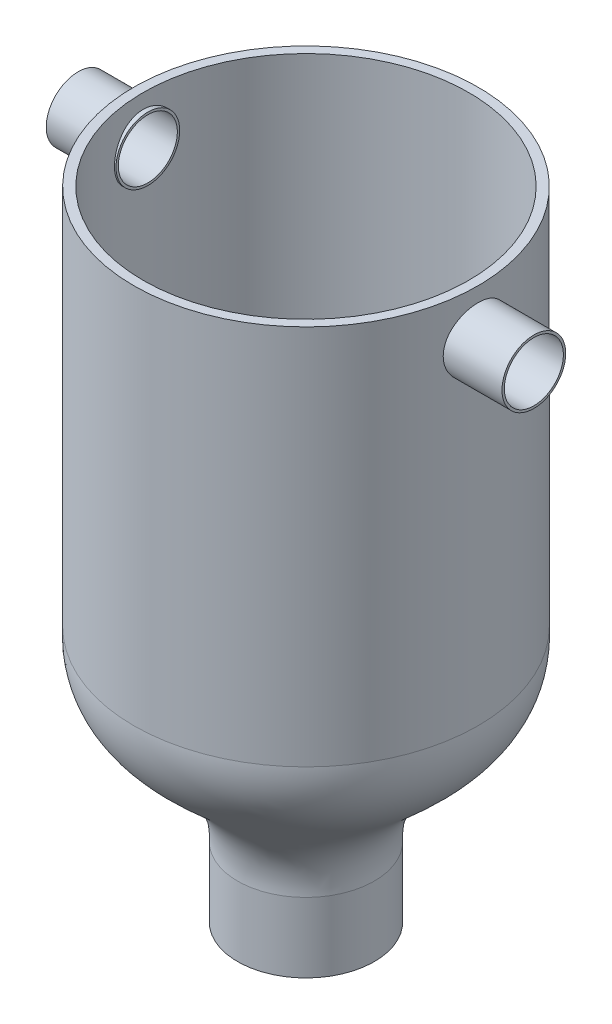
from build123d import *

# Parameters (mm, degrees)
REVOLVE1_OUTLINE_W   = 2
REVOLVE1_OUTLINE_H   = 0.065149557
REVOLVE1_OUTLINE_H_2 = 81.934850443
SKETCH2_R            = 14.704320858
SKETCH2_R_2          = 12.7
BOSS_EXTRUDE1_DEPTH  = 15
SKETCH4_R            = 6.85
SKETCH4_R_2          = 6.35
BOSS_EXTRUDE2_DEPTH  = 15
SKETCH4_5_R          = 6.35
CUT_EXTRUDE4_DEPTH   = 15


# Read off the part's stored shape, not the designer's step: Revolve1
with BuildPart() as part:
    # Revolve1 outline → Revolve1 (revolve)
    with BuildSketch(Plane.XY):
        with BuildLine():
            Line((37, -80), (35, -80))
            add(Edge.make_bspline(
                [(35, -82.736135297), (35.061393787, -81.864251908), (35.063596331, -80.953652605), (35, -80)],
                knots=[0.949778886, 0.949778886, 0.949778886, 0.949778886, 1, 1, 1, 1], degree=3))
            Line((35, -82.736135297), (35, -90.191453928))
            add(Edge.make_bspline(
                [(37, -82.809632302), (36.978250196, -83.133593549), (36.836525309, -84.679504253), (36.291315776, -87.236669301), (35.466188994, -89.257499139), (35, -90.191453928)],
                knots=[0.049019822, 0.049019822, 0.049019822, 0.049019822, 0.065850528, 0.130607861, 0.192149403, 0.192149403, 0.192149403, 0.192149403], degree=3))
            Line((37, -82.809632302), (37, -80))
        make_face()
        with Locations((36, -79.967425222)):
            Rectangle(REVOLVE1_OUTLINE_W, REVOLVE1_OUTLINE_H)
        with Locations((36, -38.967425222)):
            Rectangle(REVOLVE1_OUTLINE_W, REVOLVE1_OUTLINE_H_2)
        with BuildLine():
            Line((35, -90.191453928), (35, -82.736135297))
            add(Edge.make_bspline(
                [(14.704320858, -110.244560848), (20.054036969, -100.115230984), (34.086034038, -95.715815826), (35, -82.736135297)],
                knots=[0.202139894, 0.202139894, 0.202139894, 0.202139894, 0.949778886, 0.949778886, 0.949778886, 0.949778886], degree=3))
            Line((14.704320858, -110.244560848), (14.704320858, -117.285873132))
            add(Edge.make_bspline(
                [(35, -90.191453928), (34.975639762, -90.240256798), (34.45702902, -91.268889263), (32.726216422, -94.078605796), (29.146939349, -97.974747486), (24.460164947, -102.071263287), (20.799332913, -105.409677741), (18.343997049, -108.22260362), (16.80785122, -110.444015707), (15.632767984, -112.827491945), (14.992343266, -115.009334782), (14.767034778, -116.556856281), (14.713257918, -117.169892816), (14.704320858, -117.285873132)],
                knots=[0.192149403, 0.192149403, 0.192149403, 0.192149403, 0.195365194, 0.260122527, 0.389637193, 0.519151859, 0.648666525, 0.713423858, 0.778181191, 0.842938524, 0.907695857, 0.940074524, 0.947557367, 0.947557367, 0.947557367, 0.947557367], degree=3))
        make_face()
        with BuildLine():
            Line((37.004062891, -80), (37, -80))
            Line((37, -80), (37, -82.809632302))
            add(Edge.make_bspline(
                [(37.046583204, -81.395692582), (37.046583204, -81.564202099), (37.041161168, -82.043595425), (37.020092152, -82.510361628), (37, -82.809632302)],
                knots=[0.025114713, 0.025114713, 0.025114713, 0.025114713, 0.033471862, 0.049019822, 0.049019822, 0.049019822, 0.049019822], degree=3))
            add(Edge.make_bspline(
                [(37.004062891, -80), (37.032293763, -80.46346296), (37.046583201, -80.933027256), (37.046583204, -81.395692582)],
                knots=[0.002169048, 0.002169048, 0.002169048, 0.002169048, 0.025114713, 0.025114713, 0.025114713, 0.025114713], degree=3))
        make_face()
        with BuildLine():
            Line((37, -79.934850443), (37, -80))
            Line((37, -80), (37.004062891, -80))
            add(Edge.make_bspline(
                [(37, -79.934850443), (37.001384922, -79.956552656), (37.002739231, -79.978269621), (37.004062891, -80)],
                knots=[0.001093195, 0.001093195, 0.001093195, 0.001093195, 0.002169048, 0.002169048, 0.002169048, 0.002169048], degree=3))
        make_face()
        with BuildLine():
            Line((14.704320858, -117.285873132), (14.704320858, -110.244560848))
            add(Edge.make_bspline(
                [(12.7, -117.270986606), (12.884709132, -114.610258369), (13.614286943, -112.308467205), (14.704320858, -110.244560848)],
                knots=[0.049804361, 0.049804361, 0.049804361, 0.049804361, 0.202139894, 0.202139894, 0.202139894, 0.202139894], degree=3))
            Line((12.7, -117.270986606), (12.7, -120))
            Line((12.7, -120), (14.704320858, -120))
            add(Edge.make_bspline(
                [(14.704320858, -117.285873132), (14.674586775, -117.671745909), (14.646670593, -118.324994605), (14.658389537, -119.148529578), (14.681458624, -119.648442598), (14.697530226, -119.897656067), (14.704320858, -120)],
                knots=[0.947557367, 0.947557367, 0.947557367, 0.947557367, 0.97245319, 0.988642524, 0.99673719, 1.002239102, 1.002239102, 1.002239102, 1.002239102], degree=3))
        make_face()
        with BuildLine():
            Line((12.7, -120), (12.7, -117.270986606))
            add(Edge.make_bspline(
                [(12.7, -120), (12.637463296, -119.049142305), (12.639611462, -118.140881275), (12.7, -117.270986606)],
                knots=[0, 0, 0, 0, 0.049804361, 0.049804361, 0.049804361, 0.049804361], degree=3))
        make_face()
    revolve(axis=Axis((0, 0, 0), (0, 1, 0)))

    # Sketch2 → Boss-Extrude1 (add)
    with BuildSketch(Plane.XZ.offset(120)):
        with Locations(Location((0, 0, 0), (0, 0, 270))):
            Circle(SKETCH2_R)
        with Locations(Location((0, 0, 0), (0, 0, 90))):
            Circle(SKETCH2_R_2, mode=Mode.SUBTRACT)
    extrude(amount=BOSS_EXTRUDE1_DEPTH)

    # Sketch4 → Boss-Extrude2 (add)
    with BuildSketch(Plane(origin=(-34, 0, 0), x_dir=(0, 0, -1), z_dir=(1, 0, 0))):
        with Locations((0, -8)):
            Circle(SKETCH4_R)
        with Locations((0, -8)):
            Circle(SKETCH4_R_2, mode=Mode.SUBTRACT)
    boss_extrude2 = extrude(amount=-BOSS_EXTRUDE2_DEPTH)

    # Sketch4<5> → Cut-Extrude4 (cut)
    with BuildSketch(Plane(origin=(-34, 0, 0), x_dir=(0, 0, -1), z_dir=(1, 0, 0))):
        with Locations((0, -8)):
            Circle(SKETCH4_5_R)
    cut_extrude4 = extrude(amount=-CUT_EXTRUDE4_DEPTH, mode=Mode.SUBTRACT)

    # Mirror1: Boss-Extrude2, Cut-Extrude4 across plane
    add(boss_extrude2.mirror(Plane(origin=(0, 0, 0), x_dir=(0, 0, 1), z_dir=(1, 0, 0))))
    add(cut_extrude4.mirror(Plane(origin=(0, 0, 0), x_dir=(0, 0, 1), z_dir=(1, 0, 0))), mode=Mode.SUBTRACT)


solid = part.part
